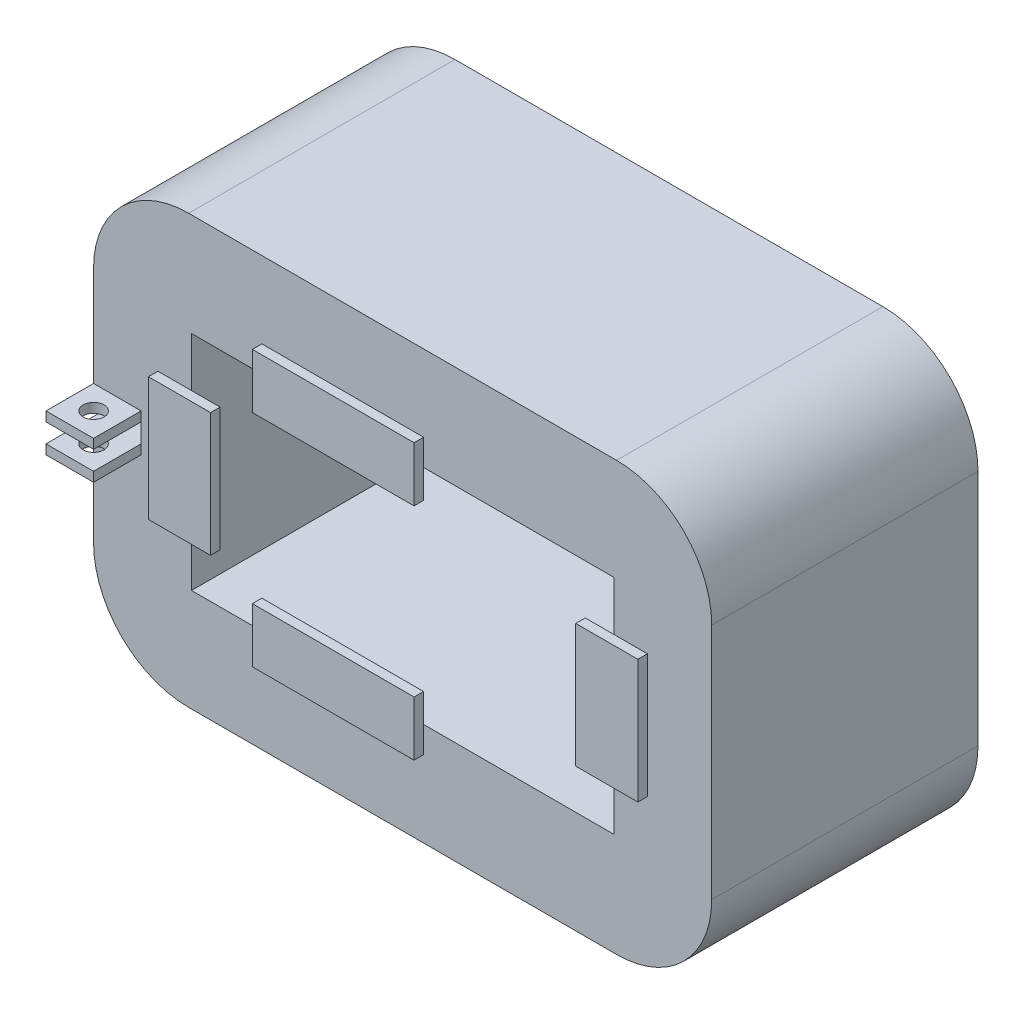
from build123d import *

# Parameters (mm, degrees)
SKETCH_1_W               = 65
SKETCH_1_H               = 45
EXTRUDE_1_DEPTH          = 28
SKETCH_2_W               = 44.4
SKETCH_2_H               = 23.4
CUT_EXTRUDE_1_DEPTH      = 39
FILLET_1_R               = 10
FILLET_2_R               = 10
FILLET_3_R               = 10
FILLET_4_R               = 10
EXTRUDE_6_DEPTH          = 1
EXTRUDE_6_2_DEPTH        = 1
EXTRUDE_6_3_DEPTH        = 1
SKETCH_10_W              = 17
SKETCH_10_H              = 5.754584259
EXTRUDE_6_4_DEPTH        = 1
CUT_EXTRUDE_3_DEPTH      = 1
CUT_EXTRUDE_3_DEPTH_BACK = 1
SKETCH_19_W              = 5
SKETCH_19_H              = 30.097075205
SKETCH_20_W              = 5
SKETCH_20_H              = 1
EXTRUDE_12_DEPTH         = 5
SKETCH_21_W              = 5
SKETCH_21_H              = 1
EXTRUDE_13_DEPTH         = 5
CUT_EXTRUDE_4_DEPTH      = 5
CUT_EXTRUDE_4_DEPTH_BACK = 5
SKETCH_22_R              = 1.1


with BuildPart() as part:
    # 草圖1 → 填料-伸長1 (new body)
    with BuildSketch(Plane.XY):
        with Locations((-27.434655272, 0)):
            Rectangle(SKETCH_1_W, SKETCH_1_H)
    extrude(amount=EXTRUDE_1_DEPTH)

    # 草圖2 → 除料-伸長1 (cut)
    with BuildSketch(Plane.XY):
        with Locations((-27.434655272, 0)):
            Rectangle(SKETCH_2_W, SKETCH_2_H)
    extrude(amount=CUT_EXTRUDE_1_DEPTH, mode=Mode.SUBTRACT)

    # 圓角1
    fillet_1_edges = [part.edges().sort_by_distance(p)[0] for p in [
        (-59.934655272, -22.5, 14),
    ]]
    fillet(fillet_1_edges, radius=FILLET_1_R)

    # 圓角2
    fillet_2_edges = [part.edges().sort_by_distance(p)[0] for p in [
        (-59.934655272, 22.5, 14),
    ]]
    fillet(fillet_2_edges, radius=FILLET_2_R)

    # 圓角3
    fillet_3_edges = [part.edges().sort_by_distance(p)[0] for p in [
        (5.065344728, 22.5, 14),
    ]]
    fillet(fillet_3_edges, radius=FILLET_3_R)

    # 圓角4
    fillet_4_edges = [part.edges().sort_by_distance(p)[0] for p in [
        (5.065344728, -22.5, 14),
    ]]
    fillet(fillet_4_edges, radius=FILLET_4_R)

    # 草圖19 → 除料-伸長3 (cut, two sides: drawn at the far end of the back side and taken through both)
    with BuildSketch(Plane(origin=(0, 0, 0), x_dir=(1, 0, 0), z_dir=(0, 1, 0)).offset(-CUT_EXTRUDE_3_DEPTH_BACK)):
        with Locations((-57.434655272, -13.951462398)):
            Rectangle(SKETCH_19_W, SKETCH_19_H)
    extrude(amount=CUT_EXTRUDE_3_DEPTH + CUT_EXTRUDE_3_DEPTH_BACK, mode=Mode.SUBTRACT)

    # 草圖20 → 填料-伸長12 (add)
    with BuildSketch(Plane.XY):
        with Locations((-57.434655272, 1.5)):
            Rectangle(SKETCH_20_W, SKETCH_20_H)
        with Locations((-57.434655272, -1.5)):
            Rectangle(SKETCH_20_W, SKETCH_20_H)
    extrude(amount=-EXTRUDE_12_DEPTH)

    # 草圖21 → 填料-伸長13 (add)
    with BuildSketch(Plane.XY.offset(28)):
        with Locations((-57.434655272, 1.5)):
            Rectangle(SKETCH_21_W, SKETCH_21_H)
        with Locations((-57.434655272, -1.5)):
            Rectangle(SKETCH_21_W, SKETCH_21_H)
    extrude(amount=EXTRUDE_13_DEPTH)

    # 草圖22 → 除料-伸長4 (cut, two sides: drawn at the far end of the back side and taken through both)
    with BuildSketch(Plane(origin=(0, 0, 0), x_dir=(1, 0, 0), z_dir=(0, 1, 0)).offset(-CUT_EXTRUDE_4_DEPTH_BACK)):
        with Locations((-57.434655272, -30.5)):
            Circle(SKETCH_22_R)
        with Locations((-57.434655272, 2.5)):
            Circle(SKETCH_22_R)
    extrude(amount=CUT_EXTRUDE_4_DEPTH + CUT_EXTRUDE_4_DEPTH_BACK, mode=Mode.SUBTRACT)


with BuildPart() as body_2:
    # 草圖10 → 填料-伸長6 (new body)
    with BuildSketch(Plane.XY.offset(29)):
        Polygon((-49.634655272, 6.5), (-53.165057103, 6.5), (-53.165057103, -6.5), (-46.634655272, -6.5), (-46.634655272, 6.5), align=None)
    extrude(amount=-EXTRUDE_6_DEPTH)


with BuildPart() as body_3:
    # 草圖10 → Extrude 6 2 (new body)
    with BuildSketch(Plane.XY.offset(29)):
        Polygon((-42.234655272, -11.7), (-42.234655272, -8.7), (-25.234655272, -8.7), (-25.234655272, -14.454584259), (-42.234655272, -14.454584259), align=None)
    extrude(amount=-EXTRUDE_6_2_DEPTH)


with BuildPart() as body_4:
    # 草圖10 → Extrude 6 3 (new body)
    with BuildSketch(Plane.XY.offset(29)):
        Polygon((-8.234655272, 6.5), (-8.234655272, -6.5), (-5.234655272, -6.5), (-1.70425344, -6.5), (-1.70425344, 6.5), align=None)
    extrude(amount=-EXTRUDE_6_3_DEPTH)


with BuildPart() as body_5:
    # 草圖10 → Extrude 6 4 (new body)
    with BuildSketch(Plane.XY.offset(29)):
        with Locations((-33.734655272, 11.57729213)):
            Rectangle(SKETCH_10_W, SKETCH_10_H)
    extrude(amount=-EXTRUDE_6_4_DEPTH)


solid = Compound([part.part, body_2.part, body_3.part, body_4.part, body_5.part])
